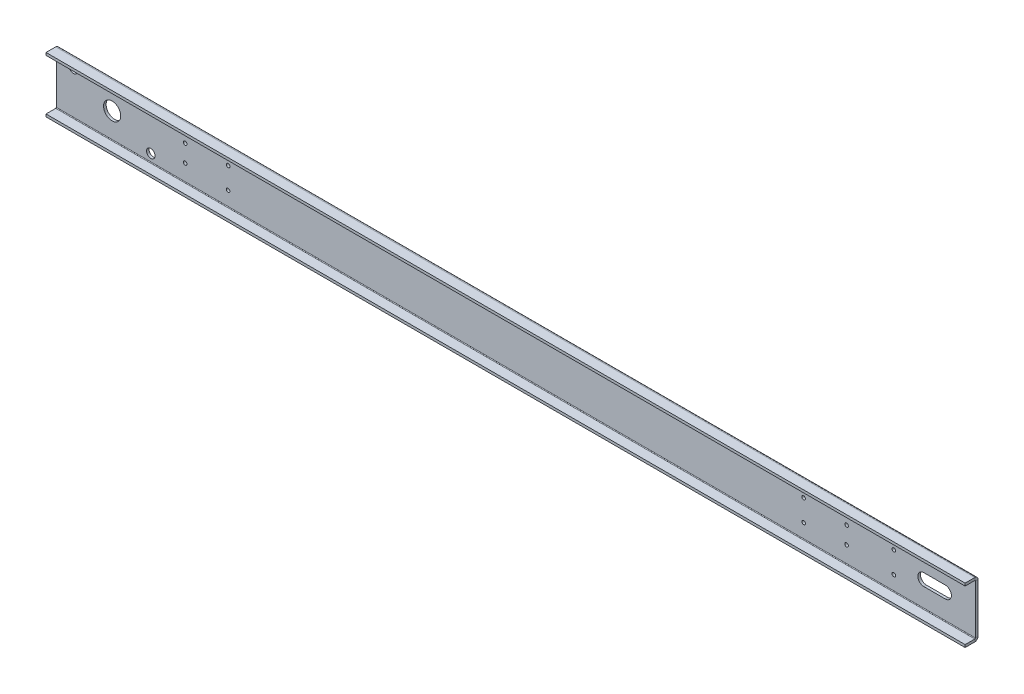
from build123d import *

# Parameters (mm, degrees)
TABAN_FLAN_1_DEPTH    = 535
KES_EKSTR_ZYON1_DEPTH = 10
M5_DI_LI_DELIK1_D     = 4.2
M5_DI_LI_DELIK2_D     = 4.2
M5_DI_LI_DELIK3_D     = 4.2
IZIM13_R              = 10
IZIM13_R_2            = 5
KES_EKSTR_ZYON2_DEPTH = 10


# Sheet-metal steps are written as plain solids
with BuildPart() as part:
    # Çizim1 → Taban-Flanş1 (new, symmetric)
    with BuildSketch(Plane(origin=(0, 0, 0), x_dir=(0, 0, -1), z_dir=(1, 0, 0))):
        with BuildLine():
            Line((-15, -32.5), (-3.7366, -32.5))
            ThreePointArc((-3.7366, -32.5), (-1.094424801, -31.405575199), (0, -28.7634))
            Line((0, -28.7634), (0, 28.7634))
            ThreePointArc((0, 28.7634), (-1.094424801, 31.405575199), (-3.7366, 32.5))
            Line((-3.7366, 32.5), (-15, 32.5))
            Line((-15, 32.5), (-15, 29.5))
            Line((-15, 29.5), (-3.7366, 29.5))
            ThreePointArc((-3.7366, 29.5), (-3.215745145, 29.284254855), (-3, 28.7634))
            Line((-3, 28.7634), (-3, -28.7634))
            ThreePointArc((-3, -28.7634), (-3.215745145, -29.284254855), (-3.7366, -29.5))
            Line((-3.7366, -29.5), (-15, -29.5))
            Line((-15, -29.5), (-15, -32.5))
        make_face()
    extrude(amount=TABAN_FLAN_1_DEPTH, both=True)

    # Çizim6 → Kes-Ekstrüzyon1 (cut)
    with BuildSketch(Plane(origin=(0, 0, 0), x_dir=(-1, 0, 0), z_dir=(0, 0, -1))):
        with BuildLine():
            Line((-500, 7), (-475, 7))
            ThreePointArc((-475, 7), (-468, 0), (-475, -7))
            Line((-475, -7), (-500, -7))
            ThreePointArc((-500, -7), (-507, 0), (-500, 7))
        make_face()
    extrude(amount=-KES_EKSTR_ZYON1_DEPTH, mode=Mode.SUBTRACT)

    # M5 Dişli Delik1 (through all)
    with Locations(Plane(origin=(440, 12.5, 0), x_dir=(-1, 0, 0), z_dir=(0, 0, -1))):
        with Locations((0, 0), (0, -25)):
            Hole(M5_DI_LI_DELIK1_D / 2)

    # M5 Dişli Delik2 (through all)
    with Locations(Plane(origin=(385, 10, 0), x_dir=(-1, 0, 0), z_dir=(0, 0, -1))):
        with Locations((0, 0), (0, -20)):
            m5_di_li_delik2 = Hole(M5_DI_LI_DELIK2_D / 2)

    # M5 Dişli Delik3 (through all)
    with Locations(Plane(origin=(335, 12.5, 0), x_dir=(-1, 0, 0), z_dir=(0, 0, -1))):
        with Locations((0, 0), (0, -25)):
            m5_di_li_delik3 = Hole(M5_DI_LI_DELIK3_D / 2)

    # Aynalama1: M5 Dişli Delik2, M5 Dişli Delik3 across plane
    add(m5_di_li_delik2.mirror(Plane(origin=(0, 0, 0), x_dir=(0, 0, 1), z_dir=(1, 0, 0))), mode=Mode.SUBTRACT)
    add(m5_di_li_delik3.mirror(Plane(origin=(0, 0, 0), x_dir=(0, 0, 1), z_dir=(1, 0, 0))), mode=Mode.SUBTRACT)

    # Çizim13 → Kes-Ekstrüzyon2 (cut)
    with BuildSketch(Plane(origin=(0, 0, 0), x_dir=(-1, 0, 0), z_dir=(0, 0, -1))):
        with Locations((470, 0)):
            Circle(IZIM13_R)
        with Locations((515, 20.289920322)):
            Circle(IZIM13_R_2)
        with Locations((425, -20.289920322)):
            Circle(IZIM13_R_2)
    extrude(amount=-KES_EKSTR_ZYON2_DEPTH, mode=Mode.SUBTRACT)


solid = part.part
